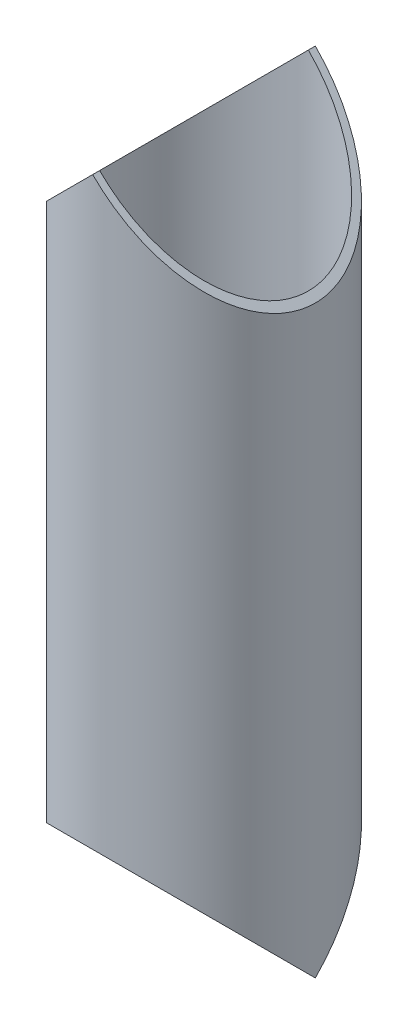
from build123d import *

# Parameters (mm, degrees)
SKETCH1_R               = 25.4
SKETCH1_R_2             = 23.8125
BOSS_EXTRUDE1_DEPTH     = 158.75
CUT_EXTRUDE1_DEPTH      = 163.763271348
CUT_EXTRUDE1_DEPTH_BACK = 163.763271348
CUT_EXTRUDE2_DEPTH      = 163.763271348
CUT_EXTRUDE2_DEPTH_BACK = 163.763271348


with BuildPart() as part:
    # Sketch1 → Boss-Extrude1 (new body)
    with BuildSketch(Plane(origin=(0, 0, 0), x_dir=(1, 0, 0), z_dir=(0, 1, 0))):
        Circle(SKETCH1_R)
        Circle(SKETCH1_R_2, mode=Mode.SUBTRACT)
    extrude(amount=BOSS_EXTRUDE1_DEPTH)

    # Sketch2 → Cut-Extrude1 (cut, two sides: drawn at the far end of the back side and taken through both)
    with BuildSketch(Plane.XY.offset(-CUT_EXTRUDE1_DEPTH_BACK)):
        Polygon((25.4, 133.35), (25.4, 158.75), (-0.960093291, 166.540490079), (-25.4, 158.75), (-25.4, 133.35), (0, 158.75), align=None)
    extrude(amount=CUT_EXTRUDE1_DEPTH + CUT_EXTRUDE1_DEPTH_BACK, mode=Mode.SUBTRACT)

    # Sketch3 → Cut-Extrude2 (cut, two sides: drawn at the far end of the back side and taken through both)
    with BuildSketch(Plane(origin=(0, 0, 0), x_dir=(0, 0, -1), z_dir=(1, 0, 0)).offset(-CUT_EXTRUDE2_DEPTH_BACK)):
        Polygon((-25.4, 25.4), (-25.4, 0), (0.032632353, -12.112837501), (25.4, 0), (25.4, 25.4), (0, 0), align=None)
    extrude(amount=CUT_EXTRUDE2_DEPTH + CUT_EXTRUDE2_DEPTH_BACK, mode=Mode.SUBTRACT)


solid = part.part
